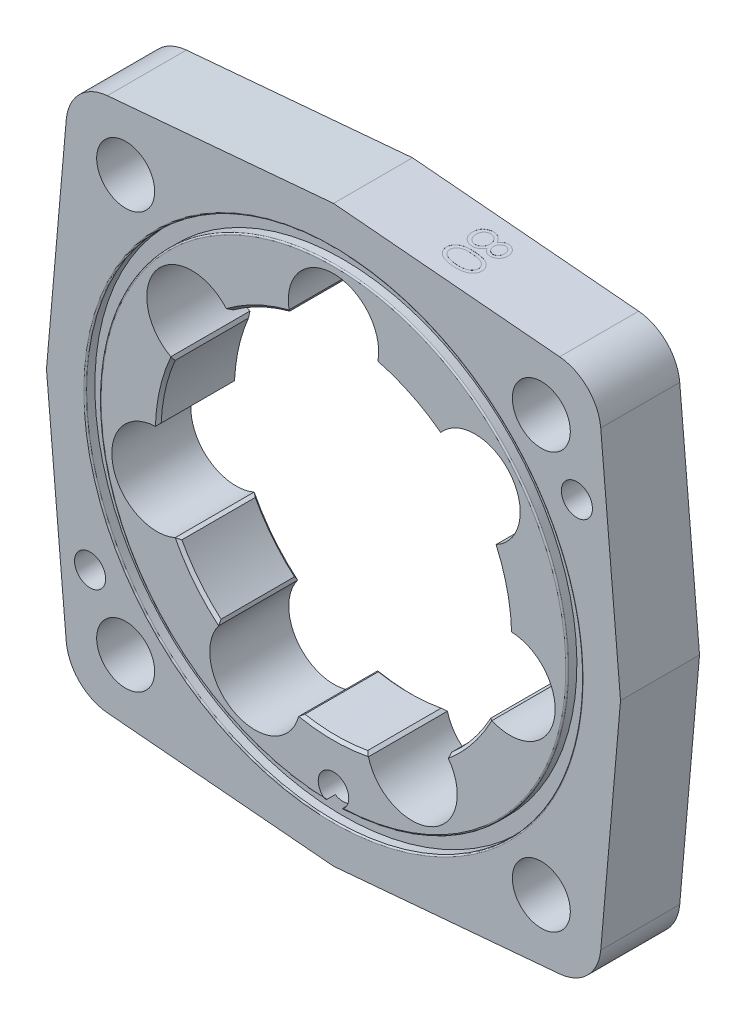
from build123d import *

# Parameters (mm, degrees)
SKETCH1_R                        = 31
EXTRUDE1_DEPTH                   = 6.985
CHAMFER1_SIZE                    = 0.5
F_12_8_12_8_DIAMETER_HOLE1_D     = 10.25
F_12_8_12_8_DIAMETER_HOLE1_DEPTH = 316
F_12_8_12_8_DIAMETER_HOLE1_TIP   = 3.079410673
SKETCH7_R                        = 43.9
SKETCH7_R_2                      = 41.34
O_RING_CUT_DEPTH                 = 1.7
EXTRUDE3_REACH                   = 75.118
SKETCH5_R                        = 7.99
CIRPATTERN1_COUNT                = 7
PIN_HOLE_REACH                   = 75.118
SKETCH6_R                        = 2.7
CUT_EXTRUDE1_DEPTH               = 0.01
SKETCH9_R                        = 2.75
CUT_EXTRUDE4_DEPTH               = 74.118300807


with BuildPart() as part:
    # Sketch1 → Extrude1 (new, symmetric)
    with BuildSketch(Plane.XY):
        with BuildLine():
            Line((0, 50.75), (-39.979900311, 47.252211954))
            ThreePointArc((-39.979900311, 47.252211954), (-44.939508619, 44.939508619), (-47.252211954, 39.979900311))
            Line((-47.252211954, 39.979900311), (-50.75, 0))
            Line((-50.75, 0), (-47.252211954, -39.979900311))
            ThreePointArc((-47.252211954, -39.979900311), (-44.939508619, -44.939508619), (-39.979900311, -47.252211954))
            Line((-39.979900311, -47.252211954), (0, -50.75))
            Line((0, -50.75), (39.979900311, -47.252211954))
            ThreePointArc((39.979900311, -47.252211954), (44.939508619, -44.939508619), (47.252211954, -39.979900311))
            Line((47.252211954, -39.979900311), (50.75, 0))
            Line((50.75, 0), (47.252211954, 39.979900311))
            ThreePointArc((47.252211954, 39.979900311), (44.939508619, 44.939508619), (39.979900311, 47.252211954))
            Line((39.979900311, 47.252211954), (0, 50.75))
        make_face()
        Circle(SKETCH1_R, mode=Mode.SUBTRACT)
    extrude(amount=EXTRUDE1_DEPTH, both=True)

    # Chamfer1
    chamfer1_edges = [part.edges().sort_by_distance(p)[0] for p in [
        (-31, 0, -6.985),
        (-31, 0, 6.985),
    ]]
    chamfer(chamfer1_edges, length=CHAMFER1_SIZE)

    # Ø12.8 (12.8) Diameter Hole1
    with Locations(Plane.XY.offset(6.985)):
        with Locations((-36.75, 36.75), (36.75, 36.75), (36.75, -36.75), (-36.75, -36.75)):
            Hole(F_12_8_12_8_DIAMETER_HOLE1_D / 2, depth=F_12_8_12_8_DIAMETER_HOLE1_DEPTH)
            with Locations((0, 0, -(F_12_8_12_8_DIAMETER_HOLE1_DEPTH + F_12_8_12_8_DIAMETER_HOLE1_TIP / 2))):  # 118° drill point
                Cone(0, F_12_8_12_8_DIAMETER_HOLE1_D / 2, F_12_8_12_8_DIAMETER_HOLE1_TIP, mode=Mode.SUBTRACT)

    # Sketch7 → O-RING CUT (cut)
    with BuildSketch(Plane.XY.offset(6.985)):
        Circle(SKETCH7_R)
        Circle(SKETCH7_R_2, mode=Mode.SUBTRACT)
    extrude(amount=-O_RING_CUT_DEPTH, mode=Mode.SUBTRACT)

    # Sketch5 → Extrude3 (cut, up to next)
    with BuildSketch(Plane.XY.offset(6.985), mode=Mode.PRIVATE) as extrude3_sk1:
        with Locations((0, 32.01)):
            Circle(SKETCH5_R)
    extrude3_tool1 = extrude(extrude3_sk1.sketch, amount=-EXTRUDE3_REACH, mode=Mode.PRIVATE) & part.part
    extrude3 = extrude3_tool1.solids().sort_by_distance((0, 32.01, 6.985))[0]
    add(extrude3, mode=Mode.SUBTRACT)

    # CirPattern1: Extrude3 ×7 about axis
    cirpattern1_axis = Axis((0, 0, 0), (0, 0, 1))
    for i in range(1, CIRPATTERN1_COUNT):
        add(extrude3.rotate(cirpattern1_axis, i * 360 / CIRPATTERN1_COUNT), mode=Mode.SUBTRACT)

    # Sketch6 → PIN HOLE (cut, up to next)
    with BuildSketch(Plane.XY.offset(6.985), mode=Mode.PRIVATE) as pin_hole_sk1:
        with Locations(Location((0, -39, 0), (0, 0, 300.901519959))):
            Circle(SKETCH6_R)
    pin_hole_tool1 = extrude(pin_hole_sk1.sketch, amount=-PIN_HOLE_REACH, mode=Mode.PRIVATE) & part.part
    add(pin_hole_tool1.solids().sort_by_distance((0, -39, 6.985))[0], mode=Mode.SUBTRACT)

    # Fillet1: read off the stored shape, not the designer's step
    # Fillet1 outline → Fillet1 (revolve, cut)
    with BuildSketch(Plane.XZ):
        with BuildLine():
            Line((41.34, 6.985), (41.09, 6.985))
            ThreePointArc((41.09, 6.985), (41.266776695, 6.911776695), (41.34, 6.735))
            Line((41.34, 6.735), (41.34, 6.985))
        make_face()
        with BuildLine():
            Line((43.9, 6.985), (43.9, 6.735))
            ThreePointArc((43.9, 6.735), (43.973223305, 6.911776695), (44.15, 6.985))
            Line((44.15, 6.985), (43.9, 6.985))
        make_face()
    revolve(axis=Axis((0, 0, 0), (0, 0, 1)), mode=Mode.SUBTRACT)

    # Chamfer2
    # the kernel refuses this chamfer: 0.500201988, 0.5 mm, written as the material it takes off along each edge
    with BuildSketch(Plane(origin=(-27.544268203, -14.223687608, -7.814427842), x_dir=(-0.9030774833281986, -0.42947765844756963, 0), z_dir=(0, 0, 1)), Plane(origin=(-28.294097093, 12.666651874, -7.814427842), x_dir=(-0.898838755534347, 0.43827946740574814, 0), z_dir=(0, 0, 1)), Plane(origin=(-7.737893777, 30.018744142, -7.814427842), x_dir=(-0.21775611185392035, 0.9760032150307, 0), z_dir=(0, 0, 1)), Plane(origin=(18.645101377, 24.766109801, -7.814427842), x_dir=(0.6273013254676859, 0.7787766349002031, 0), z_dir=(0, 0, 1)), Plane(origin=(30.987954903, 0.864089642, -7.814427842), x_dir=(0.9999880700970578, -0.004884635458422905, 0), z_dir=(0, 0, 1)), Plane(origin=(19.996246349, -23.688607641, -7.814427842), x_dir=(0.6196634019041385, -0.7848676756884502, 0), z_dir=(0, 0, 1)), Plane(origin=(-6.053043556, -30.403300211, -7.814427842), x_dir=(-0.22728044675241438, -0.9738293477422125, 0), z_dir=(0, 0, 1))) as chamfer2_piece_1:
        with BuildLine():
            Line((0.516996912, 0), (-0.020619338, 0.503902605))
            ThreePointArc((-0.020619338, 0.503902605), (-0.009577506, 0.259123147), (0, 0))
            ThreePointArc((0, 0), (0.26580762, 0.004179319), (0.516996912, 0))
        make_face()
    extrude(amount=15.628855684, mode=Mode.SUBTRACT)
    with BuildSketch(Plane(origin=(-30.987954903, 0.864089642, -7.814427842), x_dir=(-0.9999880700970578, -0.004884635458422838, 0), z_dir=(0, 0, 1)), Plane(origin=(-18.645101377, 24.766109801, -7.814427842), x_dir=(-0.6273013254676867, 0.7787766349002024, 0), z_dir=(0, 0, 1)), Plane(origin=(7.737893777, 30.018744142, -7.814427842), x_dir=(0.21775611185392052, 0.9760032150307, 0), z_dir=(0, 0, 1)), Plane(origin=(28.294097093, 12.666651874, -7.814427842), x_dir=(0.8988387555343457, 0.4382794674057509, 0), z_dir=(0, 0, 1)), Plane(origin=(27.544268203, -14.223687608, -7.814427842), x_dir=(0.9030774833281973, -0.42947765844757246, 0), z_dir=(0, 0, 1)), Plane(origin=(6.053043556, -30.403300211, -7.814427842), x_dir=(0.22728044675241613, -0.973829347742212, 0), z_dir=(0, 0, 1)), Plane(origin=(-19.996246349, -23.688607641, -7.814427842), x_dir=(-0.6196634019041427, -0.7848676756884467, 0), z_dir=(0, 0, 1))) as chamfer2_piece_2:
        with BuildLine():
            Line((0.516996912, 0), (-0.020619338, -0.503902605))
            ThreePointArc((-0.020619338, -0.503902605), (-0.009577506, -0.259123147), (0, 0))
            ThreePointArc((0, 0), (0.26580762, -0.004179319), (0.516996912, 0))
        make_face()
    extrude(amount=15.628855684, mode=Mode.SUBTRACT)

    # Sketch8 → Cut-Extrude1 (cut)
    # profile 1 of 2: a face of its own
    with BuildSketch(Plane(origin=(4.406322508, 50.364496733, 0), x_dir=(0.9961946980917461, -0.08715574274765286, 0), z_dir=(0.08715574274765286, 0.9961946980917461, 0))):
        with BuildLine():
            add(Edge.make_bspline(
                [(14.455202152, 1.384564387), (14.429562921, 1.335867793), (14.379401442, 1.240596087), (14.298892527, 1.104280345), (14.21479041, 0.97877672), (14.129735129, 0.862296621), (14.040364701, 0.757215846), (13.94769923, 0.662839075), (13.85422093, 0.576205465), (13.75627215, 0.501869658), (13.655873107, 0.43631916), (13.552160772, 0.379745352), (13.445462274, 0.331368118), (13.334586549, 0.29303295), (13.221169274, 0.261452382), (13.103744076, 0.239722869), (12.983085229, 0.228036699), (12.901539566, 0.225827308), (12.860250229, 0.224708618)],
                knots=[0, 0, 0, 0, 1.264385854, 2.473688339, 3.635349404, 4.734491366, 5.785876313, 6.801388178, 7.772322209, 8.711311751, 9.622826105, 10.524996139, 11.423212571, 12.31118177, 13.217849097, 14.126010572, 15.051135535, 16, 16, 16, 16], degree=3))
            add(Edge.make_bspline(
                [(12.860250229, 0.224708618), (12.80247872, 0.22601929), (12.688127228, 0.228613601), (12.519420137, 0.2515846), (12.355181348, 0.285110294), (12.19699869, 0.337317048), (12.042889937, 0.399674765), (11.895672849, 0.479894318), (11.751230866, 0.569918133), (11.662406635, 0.642373356), (11.617461767, 0.679035541)],
                knots=[0, 0, 0, 0, 1.02534174, 2.029536028, 3.018826961, 3.997522084, 4.983122576, 5.966563916, 6.971085759, 8, 8, 8, 8], degree=3))
            add(Edge.make_bspline(
                [(11.617461767, 0.679035541), (11.565015297, 0.726755211), (11.460770452, 0.821604867), (11.325426207, 0.984089885), (11.211684388, 1.162413115), (11.118989712, 1.355884542), (11.046842525, 1.563987002), (10.994998209, 1.786676152), (10.965302616, 2.024386129), (10.961010062, 2.187766937), (10.958807921, 2.271583618)],
                knots=[0, 0, 0, 0, 0.954267603, 1.896743057, 2.838368354, 3.796610408, 4.779680527, 5.799409237, 6.871065594, 8, 8, 8, 8], degree=3))
            add(Edge.make_bspline(
                [(10.958807921, 2.271583618), (10.960788899, 2.352176143), (10.964643682, 2.509001009), (10.990618287, 2.737297207), (11.03660326, 2.950363494), (11.098241636, 3.14921001), (11.180437806, 3.331914156), (11.281186557, 3.498807465), (11.398212246, 3.652338473), (11.534335221, 3.787681832), (11.680152783, 3.907831726), (11.830583076, 4.013377399), (11.98564624, 4.101104279), (12.143028515, 4.175379329), (12.304936226, 4.232238789), (12.470536243, 4.271619723), (12.639539347, 4.296629975), (12.753593609, 4.299957635), (12.810971382, 4.301631695)],
                knots=[0, 0, 0, 0, 1.256882982, 2.445766618, 3.576898315, 4.651879663, 5.686612882, 6.692806257, 7.686348993, 8.689277895, 9.678883454, 10.630458183, 11.551151498, 12.454054546, 13.341321255, 14.221808008, 15.105437234, 16, 16, 16, 16], degree=3))
            add(Edge.make_bspline(
                [(12.810971382, 4.301631695), (12.853072886, 4.30064109), (12.936280318, 4.298683304), (13.059210134, 4.285131444), (13.178862359, 4.26334807), (13.295668745, 4.233750961), (13.408816633, 4.193687162), (13.518701384, 4.145140945), (13.626167275, 4.08908346), (13.729366841, 4.021892429), (13.831739385, 3.947918373), (13.928284611, 3.860168328), (14.024380863, 3.763927101), (14.115870062, 3.655265277), (14.207149543, 3.537508724), (14.29241042, 3.407088337), (14.377890986, 3.267668325), (14.428989599, 3.168571915), (14.455202152, 3.117737464)],
                knots=[0, 0, 0, 0, 0.941717298, 1.86116577, 2.762973304, 3.660719123, 4.553575492, 5.444450535, 6.34648071, 7.261375261, 8.197060099, 9.168336537, 10.175980388, 11.237504102, 12.343496232, 13.506792996, 14.721035322, 16, 16, 16, 16], degree=3))
            add(Edge.make_bspline(
                [(14.455202152, 3.117737464), (14.493141558, 3.187329886), (14.566602867, 3.322080293), (14.701677465, 3.500387414), (14.84743647, 3.653791709), (15.008697263, 3.77634811), (15.178357317, 3.87359762), (15.35587295, 3.942271867), (15.539118586, 3.987116999), (15.664078893, 3.991658529), (15.726836767, 3.993939387)],
                knots=[0, 0, 0, 0, 1.16709546, 2.25982348, 3.287408737, 4.277418348, 5.234967981, 6.16072867, 7.076276605, 8, 8, 8, 8], degree=3))
            add(Edge.make_bspline(
                [(15.726836767, 3.993939387), (15.790775371, 3.991135749), (15.919303115, 3.985499947), (16.110628942, 3.939929376), (16.298538865, 3.865663051), (16.482148092, 3.764668903), (16.655141648, 3.638811029), (16.810820961, 3.487845775), (16.946012587, 3.314356239), (17.060226904, 3.121422739), (17.153647154, 2.914202535), (17.21741944, 2.69518933), (17.259363652, 2.468296964), (17.264099157, 2.31384078), (17.266500229, 2.235525926)],
                knots=[0, 0, 0, 0, 0.888753872, 1.786550278, 2.720173491, 3.693036334, 4.694165094, 5.687489879, 6.699912706, 7.744713188, 8.800178723, 9.852977058, 10.911381959, 12, 12, 12, 12], degree=3))
            add(Edge.make_bspline(
                [(17.266500229, 2.235525926), (17.264031403, 2.15923092), (17.259163161, 2.008785861), (17.21816256, 1.787315157), (17.150445308, 1.575234434), (17.058239867, 1.37370096), (16.943256911, 1.187118182), (16.806701442, 1.020528643), (16.651569143, 0.874398558), (16.479044102, 0.752986519), (16.295439328, 0.655005939), (16.104486991, 0.585228796), (15.908745902, 0.540844846), (15.776345464, 0.535219401), (15.710009844, 0.532400926)],
                knots=[0, 0, 0, 0, 1.072712831, 2.115267497, 3.156282165, 4.197922255, 5.225560591, 6.230883479, 7.219814004, 8.214446311, 9.19021444, 10.138875805, 11.067534608, 12, 12, 12, 12], degree=3))
            add(Edge.make_bspline(
                [(15.710009844, 0.532400926), (15.644906605, 0.534859819), (15.517047545, 0.539688946), (15.330664732, 0.580322454), (15.156092117, 0.64872647), (14.991473567, 0.742216373), (14.83908667, 0.863876333), (14.699438078, 1.013497936), (14.566976423, 1.186437801), (14.493293077, 1.317045943), (14.455202152, 1.384564387)],
                knots=[0, 0, 0, 0, 0.975287281, 1.915408787, 2.843441052, 3.776938647, 4.743139116, 5.754296123, 6.83907365, 8, 8, 8, 8], degree=3))
        make_face()
        with BuildLine():
            add(Edge.make_bspline(
                [(16.651115613, 2.265574003), (16.649998858, 2.307661098), (16.647813996, 2.39000186), (16.63639919, 2.510736725), (16.614193676, 2.625546498), (16.584641599, 2.735630727), (16.544719333, 2.83948012), (16.49775646, 2.93850507), (16.440660348, 3.031020253), (16.37661258, 3.118142487), (16.306167598, 3.196572386), (16.232772652, 3.266180189), (16.154986265, 3.323999813), (16.074743363, 3.373098858), (15.989662375, 3.408724316), (15.902351787, 3.43540598), (15.811708271, 3.453442651), (15.749759968, 3.454794177), (15.718423305, 3.455477849)],
                knots=[0, 0, 0, 0, 1.203892937, 2.355340988, 3.463153438, 4.544400666, 5.610487187, 6.640501085, 7.674077295, 8.714426146, 9.728707835, 10.68524104, 11.601827946, 12.495867327, 13.368432065, 14.231010473, 15.105153427, 16, 16, 16, 16], degree=3))
            add(Edge.make_bspline(
                [(15.718423305, 3.455477849), (15.687099408, 3.454258813), (15.625198888, 3.451849822), (15.533422727, 3.434413466), (15.444408693, 3.405259733), (15.357325817, 3.365283696), (15.272397624, 3.313981937), (15.189298673, 3.25171692), (15.110226452, 3.175786985), (15.032937527, 3.091937422), (14.961730097, 3.000346613), (14.898123723, 2.904101334), (14.847417282, 2.80249918), (14.802958095, 2.6985829), (14.76960855, 2.590154911), (14.745582168, 2.477962831), (14.730720352, 2.362126505), (14.728939651, 2.283646841), (14.72803869, 2.243939387)],
                knots=[0, 0, 0, 0, 0.873213166, 1.72559466, 2.594724523, 3.479581045, 4.391597569, 5.35687048, 6.368548091, 7.443976143, 8.534559525, 9.600545123, 10.654815915, 11.696401765, 12.749428718, 13.812189468, 14.893058657, 16, 16, 16, 16], degree=3))
            add(Edge.make_bspline(
                [(14.72803869, 2.243939387), (14.729535034, 2.192939209), (14.732512942, 2.091442579), (14.760200668, 1.941820868), (14.80375367, 1.796342049), (14.863342184, 1.65656107), (14.938132801, 1.526096067), (15.027675117, 1.409798807), (15.12990157, 1.308661276), (15.243220717, 1.223734516), (15.363823439, 1.157889065), (15.484852513, 1.106628823), (15.607599194, 1.076695311), (15.689828275, 1.07279091), (15.730442536, 1.070862464)],
                knots=[0, 0, 0, 0, 1.076279235, 2.141928126, 3.20205304, 4.278698113, 5.344010996, 6.36967002, 7.368914609, 8.37248503, 9.349703398, 10.264243087, 11.142681841, 12, 12, 12, 12], degree=3))
            add(Edge.make_bspline(
                [(15.730442536, 1.070862464), (15.758949115, 1.071771931), (15.815530589, 1.073577093), (15.899061856, 1.088526142), (15.980790011, 1.113037633), (16.060734863, 1.146846742), (16.140020586, 1.188730217), (16.215300011, 1.242835959), (16.290762618, 1.30425511), (16.363064151, 1.375603907), (16.43114484, 1.456037906), (16.489711741, 1.546826934), (16.540576148, 1.645661594), (16.581446397, 1.753348214), (16.612228082, 1.869466596), (16.635255081, 1.993573216), (16.648239484, 2.126676682), (16.65013611, 2.218270726), (16.651115613, 2.265574003)],
                knots=[0, 0, 0, 0, 0.814272661, 1.61621452, 2.416847352, 3.248328223, 4.093649164, 4.973549185, 5.892801723, 6.872536627, 7.872406081, 8.898230315, 9.953166191, 11.044090313, 12.18293744, 13.382234284, 14.648068262, 16, 16, 16, 16], degree=3))
        make_face(mode=Mode.SUBTRACT)
        with BuildLine():
            add(Edge.make_bspline(
                [(14.112654075, 2.230718233), (14.111705333, 2.284076914), (14.109844132, 2.388753625), (14.089114216, 2.542105656), (14.060282242, 2.689292351), (14.016448456, 2.829759494), (13.959923289, 2.963334879), (13.890766202, 3.090319403), (13.810239512, 3.210892754), (13.71790327, 3.323079326), (13.617900778, 3.425292982), (13.513387335, 3.51654411), (13.403612261, 3.592500413), (13.289554784, 3.654566598), (13.171356994, 3.702644988), (13.049042628, 3.738145536), (12.922246097, 3.758753083), (12.836284038, 3.76168959), (12.792942536, 3.763170156)],
                knots=[0, 0, 0, 0, 1.140506561, 2.237395584, 3.304560074, 4.345354409, 5.3782877, 6.402081073, 7.433555996, 8.474808822, 9.504965884, 10.489266388, 11.437701257, 12.354123303, 13.261162422, 14.161620169, 15.073101032, 16, 16, 16, 16], degree=3))
            add(Edge.make_bspline(
                [(12.792942536, 3.763170156), (12.739057534, 3.760839589), (12.632150949, 3.756215797), (12.474208297, 3.7193373), (12.320873005, 3.660610607), (12.174843041, 3.576681342), (12.037937528, 3.474929898), (11.917231397, 3.35062722), (11.81229442, 3.208632117), (11.72625156, 3.047528151), (11.657231849, 2.871791099), (11.610269439, 2.680965501), (11.578945605, 2.477745478), (11.57580186, 2.33741236), (11.574192536, 2.265574003)],
                knots=[0, 0, 0, 0, 0.898956152, 1.783507998, 2.694187257, 3.631865312, 4.587204618, 5.533364321, 6.51415483, 7.525942309, 8.574485006, 9.65837228, 10.801290154, 12, 12, 12, 12], degree=3))
            add(Edge.make_bspline(
                [(11.574192536, 2.265574003), (11.575269272, 2.209430031), (11.5773671, 2.100043571), (11.595922799, 1.940474356), (11.625261948, 1.789859853), (11.668342743, 1.648273964), (11.719956143, 1.514019978), (11.787455545, 1.390100058), (11.86379179, 1.273213583), (11.954396298, 1.168847571), (12.051292756, 1.073934582), (12.153342288, 0.990802984), (12.259505593, 0.920446919), (12.369724941, 0.863733458), (12.483594158, 0.81869748), (12.601580971, 0.786231686), (12.724148741, 0.766222097), (12.80728939, 0.764196779), (12.849432921, 0.763170156)],
                knots=[0, 0, 0, 0, 1.22469164, 2.386092043, 3.500511288, 4.568136916, 5.611981868, 6.63276519, 7.641422348, 8.65223666, 9.641383647, 10.598487484, 11.519869765, 12.415254456, 13.298392158, 14.187051141, 15.081026348, 16, 16, 16, 16], degree=3))
            add(Edge.make_bspline(
                [(12.849432921, 0.763170156), (12.890370094, 0.764712864), (12.971091049, 0.767754812), (13.090624248, 0.787336728), (13.206576613, 0.820959085), (13.318449185, 0.869961862), (13.427451081, 0.930228859), (13.532776938, 1.004154372), (13.633591485, 1.092604407), (13.729999868, 1.192788427), (13.819176722, 1.301904821), (13.898056771, 1.417909125), (13.964489457, 1.539887284), (14.018517605, 1.667586749), (14.061010445, 1.800722492), (14.090694998, 1.939196988), (14.109380035, 2.083172254), (14.111550398, 2.180980605), (14.112654075, 2.230718233)],
                knots=[0, 0, 0, 0, 0.917481483, 1.809113215, 2.707052678, 3.61610275, 4.54058801, 5.494688304, 6.493986409, 7.541809048, 8.607637092, 9.648666143, 10.681335566, 11.715370464, 12.751897579, 13.808646822, 14.885650252, 16, 16, 16, 16], degree=3))
        make_face(mode=Mode.SUBTRACT)
    # profile 2 of 2: a face of its own
    with BuildSketch(Plane(origin=(4.406322508, 50.364496733, 0), x_dir=(0.9961946980917461, -0.08715574274765286, 0), z_dir=(0.08715574274765286, 0.9961946980917461, 0))):
        with BuildLine():
            add(Edge.make_bspline(
                [(14.110250229, -0.31375292), (14.206417179, -0.314315237), (14.393222866, -0.315407546), (14.665425109, -0.327559125), (14.920785606, -0.347745425), (15.159316572, -0.375409497), (15.381079611, -0.409074591), (15.585482006, -0.454015475), (15.773470055, -0.505122971), (15.945655914, -0.564356292), (16.104362303, -0.631190583), (16.252513601, -0.703941798), (16.38992172, -0.785457446), (16.518650895, -0.871217951), (16.637264448, -0.96435723), (16.745537753, -1.063892892), (16.843536189, -1.170812292), (16.932426102, -1.283000807), (17.009860548, -1.401167437), (17.079634131, -1.521669499), (17.136901577, -1.64663335), (17.18395704, -1.77491928), (17.221661389, -1.906154219), (17.247771579, -2.040880421), (17.264135648, -2.179130432), (17.265704557, -2.272440416), (17.266500229, -2.319762536)],
                knots=[0, 0, 0, 0, 1.646377244, 3.198111528, 4.663803227, 6.031090796, 7.308794487, 8.502186765, 9.612154809, 10.642545331, 11.617106989, 12.558866172, 13.465886467, 14.35053239, 15.20542558, 16.045215227, 16.865619885, 17.686225247, 18.492864914, 19.282407821, 20.068097601, 20.842842034, 21.620163247, 22.403093475, 23.190129512, 24, 24, 24, 24], degree=3))
            add(Edge.make_bspline(
                [(17.266500229, -2.319762536), (17.265663974, -2.367480499), (17.264000927, -2.462376514), (17.248017025, -2.6026743), (17.2214951, -2.739730898), (17.183916286, -2.872961992), (17.137295126, -3.003461969), (17.078860068, -3.130210097), (17.010839153, -3.253993665), (16.930912506, -3.372845587), (16.841800033, -3.488070642), (16.741064029, -3.596838578), (16.629721653, -3.699159297), (16.508964172, -3.796316963), (16.376475455, -3.88555513), (16.234559838, -3.970538156), (16.080735499, -4.046604504), (15.917568983, -4.119863947), (15.740545567, -4.183098781), (15.550663121, -4.24012663), (15.345678801, -4.286204862), (15.126668094, -4.324586472), (14.892826694, -4.354320579), (14.644655868, -4.375976537), (14.381992341, -4.387416111), (14.202407457, -4.389570456), (14.110250229, -4.390675997)],
                knots=[0, 0, 0, 0, 0.810914788, 1.612654377, 2.396697861, 3.181598691, 3.963628158, 4.749916497, 5.551656086, 6.361998678, 7.18212741, 8.025565596, 8.878627764, 9.750805457, 10.657531673, 11.591944965, 12.560506719, 13.57287815, 14.630710178, 15.753379473, 16.941251878, 18.199788006, 19.531962791, 20.947069417, 22.433333509, 24, 24, 24, 24], degree=3))
            add(Edge.make_bspline(
                [(14.110250229, -4.390675997), (14.018495301, -4.389557615), (13.839714566, -4.387378492), (13.578228154, -4.376119782), (13.331391018, -4.353837976), (13.098516057, -4.326278898), (12.880985924, -4.287021371), (12.676732172, -4.242392481), (12.487517477, -4.186923562), (12.311427668, -4.124550621), (12.149060563, -4.052880835), (11.996565962, -3.976142202), (11.854766142, -3.891680819), (11.722279352, -3.801910456), (11.600474589, -3.705578618), (11.48905082, -3.602824631), (11.388081538, -3.493570284), (11.297751509, -3.378084717), (11.218755264, -3.257363088), (11.148145327, -3.133992694), (11.090849743, -3.005511172), (11.04247397, -2.874773922), (11.004808704, -2.740547351), (10.979019552, -2.602963119), (10.960882507, -2.462471807), (10.959501844, -2.367497008), (10.958807921, -2.319762536)],
                knots=[0, 0, 0, 0, 1.56130642, 3.042141888, 4.451772327, 5.777565838, 7.030558081, 8.211376819, 9.333164717, 10.383253789, 11.387583522, 12.350962576, 13.286244149, 14.193812918, 15.072134482, 15.925989337, 16.770211267, 17.600669898, 18.417446232, 19.22325363, 20.01647746, 20.807971184, 21.593601364, 22.38506573, 23.188331689, 24, 24, 24, 24], degree=3))
            add(Edge.make_bspline(
                [(10.958807921, -2.319762536), (10.959611249, -2.272442339), (10.961195255, -2.179136146), (10.977448731, -2.040858365), (11.003952674, -1.906342283), (11.039944896, -1.775318991), (11.085688877, -1.647520348), (11.143873526, -1.524198268), (11.211358666, -1.40372409), (11.288135643, -1.286647541), (11.376120059, -1.175200032), (11.47342821, -1.068743032), (11.582500782, -0.96996454), (11.701591903, -0.877992593), (11.829691082, -0.790716209), (11.968060194, -0.709999355), (12.117599582, -0.637390044), (12.27718208, -0.569057942), (12.450633419, -0.508823323), (12.639624119, -0.456018237), (12.845199631, -0.411997811), (13.066749663, -0.376596356), (13.304440036, -0.347411418), (13.558689252, -0.327654709), (13.829277949, -0.315397868), (14.014883714, -0.314311242), (14.110250229, -0.31375292)],
                knots=[0, 0, 0, 0, 0.810940842, 1.599017053, 2.38298203, 3.159479784, 3.926441347, 4.70693857, 5.494146311, 6.292334103, 7.104379492, 7.925868426, 8.762126819, 9.623561095, 10.503686106, 11.41783325, 12.366995289, 13.351843594, 14.392337808, 15.512229747, 16.713911458, 17.994391108, 19.357476964, 20.818259213, 22.365182633, 24, 24, 24, 24], degree=3))
        make_face()
        with BuildLine():
            add(Edge.make_bspline(
                [(14.112654075, -0.852214459), (14.032513448, -0.852419225), (13.876976228, -0.852816637), (13.65095921, -0.863198695), (13.440152931, -0.877341949), (13.24428973, -0.895584177), (13.064032551, -0.92267493), (12.898141714, -0.953029477), (12.747494864, -0.989968884), (12.611059136, -1.033675207), (12.486516108, -1.083454546), (12.370634487, -1.137814336), (12.262009307, -1.196179792), (12.161743841, -1.261613657), (12.068840017, -1.332631751), (11.983564815, -1.409350689), (11.906290312, -1.491635545), (11.814596622, -1.605544761), (11.718722608, -1.755185565), (11.636263635, -1.944694425), (11.584108071, -2.13950823), (11.577493883, -2.271773624), (11.574192536, -2.337791382)],
                knots=[0, 0, 0, 0, 1.459116078, 2.831857795, 4.118796693, 5.306371758, 6.412361096, 7.436813035, 8.376339383, 9.234574298, 10.043323891, 10.816788787, 11.564361537, 12.286735248, 12.994408768, 13.691741332, 14.372975427, 15.047457468, 16.352811911, 17.594285292, 18.799233213, 20, 20, 20, 20], degree=3))
            add(Edge.make_bspline(
                [(11.574192536, -2.337791382), (11.576931589, -2.404233105), (11.58240404, -2.536979373), (11.635201875, -2.730923022), (11.714863943, -2.919203485), (11.809059666, -3.066755383), (11.898765374, -3.179011171), (11.975247628, -3.259440297), (12.060886258, -3.333260952), (12.153285051, -3.403275937), (12.254209309, -3.467491496), (12.363173724, -3.525885446), (12.480480886, -3.579171185), (12.562371868, -3.609529549), (12.604240613, -3.625050997)],
                knots=[0, 0, 0, 0, 1.353760809, 2.704726607, 4.075137775, 5.516104923, 6.260822281, 7.007110065, 7.778089737, 8.566572457, 9.372053459, 10.217411131, 11.088608312, 12, 12, 12, 12], degree=3))
            add(Edge.make_bspline(
                [(12.604240613, -3.625050997), (12.657777309, -3.643139742), (12.766479762, -3.679867652), (12.935103166, -3.727202122), (13.11202219, -3.764479949), (13.296179533, -3.798017147), (13.488933306, -3.8209081), (13.689687107, -3.839332923), (13.898592299, -3.850185529), (14.04052657, -3.851530817), (14.112654075, -3.852214459)],
                knots=[0, 0, 0, 0, 0.884706709, 1.796334032, 2.740027952, 3.714592787, 4.726048262, 5.777819803, 6.87074269, 8, 8, 8, 8], degree=3))
            add(Edge.make_bspline(
                [(14.112654075, -3.852214459), (14.184780029, -3.851460475), (14.325891268, -3.849985338), (14.532337138, -3.840293559), (14.728758867, -3.824719674), (14.915334643, -3.803640763), (15.091732382, -3.774703876), (15.258204506, -3.739953555), (15.414706138, -3.69921279), (15.56164088, -3.652481919), (15.698480611, -3.599816874), (15.825523257, -3.54163779), (15.943442323, -3.479552825), (16.051899337, -3.412106607), (16.151383847, -3.340114605), (16.239900257, -3.26167294), (16.320192212, -3.179894054), (16.411842327, -3.065350295), (16.505290949, -2.915394375), (16.591289394, -2.728801835), (16.640675039, -2.534623588), (16.647637931, -2.40335481), (16.651115613, -2.337791382)],
                knots=[0, 0, 0, 0, 1.313668642, 2.570134578, 3.763346207, 4.902004944, 5.98888779, 7.017888835, 7.998425394, 8.933058446, 9.82474457, 10.667209444, 11.476765193, 12.250262638, 12.991704352, 13.7104269, 14.401925311, 15.076585796, 16.378385137, 17.609787933, 18.806186071, 20, 20, 20, 20], degree=3))
            add(Edge.make_bspline(
                [(16.651115613, -2.337791382), (16.64763762, -2.27142758), (16.640675297, -2.138579079), (16.591418896, -1.942424796), (16.506091615, -1.754503069), (16.411238867, -1.605750231), (16.321814677, -1.491350991), (16.244051062, -1.410569156), (16.158517888, -1.335046551), (16.066007395, -1.263969291), (15.96569136, -1.198598415), (15.857081977, -1.140209074), (15.741189587, -1.085880487), (15.616674895, -1.035994275), (15.480033482, -0.992692995), (15.330146931, -0.953989639), (15.164101145, -0.923653508), (14.983340016, -0.897180915), (14.787236037, -0.876997065), (14.57594375, -0.863235002), (14.349535876, -0.852797852), (14.193196149, -0.852412818), (14.112654075, -0.852214459)],
                knots=[0, 0, 0, 0, 1.207964612, 2.418129846, 3.655795183, 4.951004962, 5.620895151, 6.296795572, 6.989224116, 7.696855977, 8.419187164, 9.166715907, 9.940135271, 10.748837255, 11.607021648, 12.548275234, 13.5654991, 14.678641405, 15.874140913, 17.15372626, 18.533675393, 20, 20, 20, 20], degree=3))
        make_face(mode=Mode.SUBTRACT)
    extrude(amount=-CUT_EXTRUDE1_DEPTH, mode=Mode.SUBTRACT)

    # Sketch9 → Cut-Extrude4 (cut, through all)
    with BuildSketch(Plane.XY.offset(-6.985)):
        with Locations(Location((43.03844088, 26.89340266, 0), (0, 0, 180))):
            Circle(SKETCH9_R)
        with Locations(Location((-43.03844088, -26.89340266, 0), (0, 0, 180))):
            Circle(SKETCH9_R)
    extrude(amount=CUT_EXTRUDE4_DEPTH, mode=Mode.SUBTRACT)


solid = part.part
